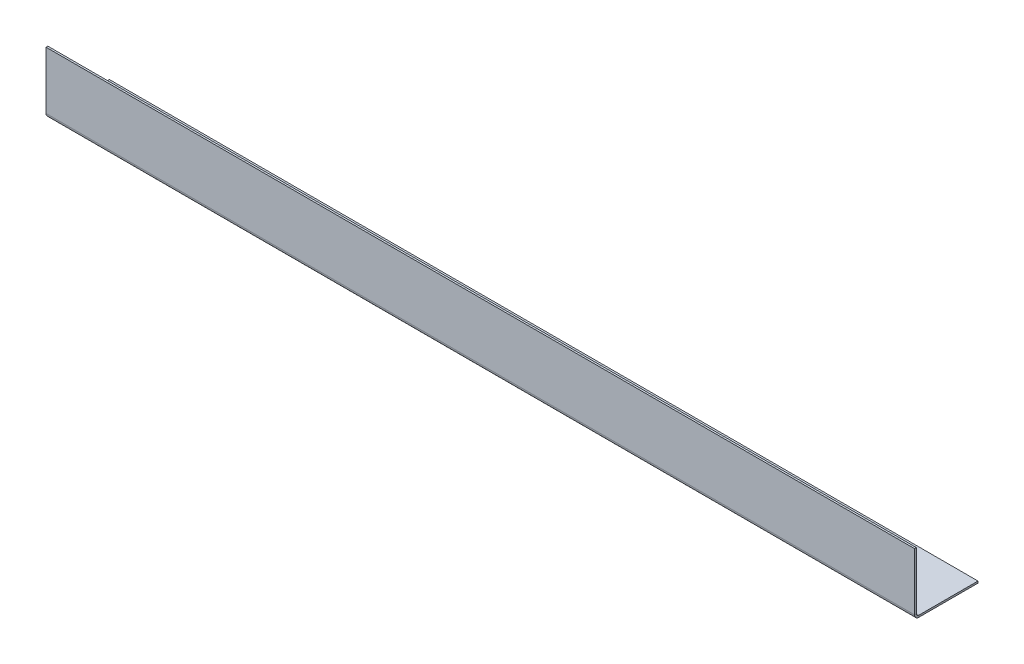
from build123d import *

# Parameters (mm, degrees)
SKETCH1_W                    = 705
SKETCH1_H                    = 50
BOSS_EXTRUDE1_DEPTH          = 2
CONVERT_SOLID1_OUTLINE_W     = 705
CONVERT_SOLID1_OUTLINE_H     = 50
CONVERT_SOLID1_DEPTH         = 0.5
EDGE_FLANGE1_STRIP_W         = 10
EDGE_FLANGE1_STRIP_H         = 1.5
EDGE_FLANGE1_STRIP_CUT_DEPTH = 705
EDGE_FLANGE1_DEPTH           = 705


# Read off the part's stored shape, not the designer's step: Convert-Solid1
# Sheet-metal steps are written as plain solids
with BuildPart() as part:
    # Sketch1 → Boss-Extrude1 (new body)
    with BuildSketch(Plane(origin=(0, 0, 0), x_dir=(1, 0, 0), z_dir=(0, 1, 0))):
        with Locations((-352.5, 25)):
            Rectangle(SKETCH1_W, SKETCH1_H)
    extrude(amount=BOSS_EXTRUDE1_DEPTH)

    # Convert-Solid1 outline → Convert-Solid1 (cut)
    with BuildSketch(Plane(origin=(0, 0, 0), x_dir=(1, 0, 0), z_dir=(0, 1, 0))):
        with Locations((-352.5, 25)):
            Rectangle(CONVERT_SOLID1_OUTLINE_W, CONVERT_SOLID1_OUTLINE_H)
    extrude(amount=CONVERT_SOLID1_DEPTH, mode=Mode.SUBTRACT)

    # Edge-Flange1 strip (across the edge) → Edge-Flange1 strip cut (cut)
    with BuildSketch(Plane(origin=(-705, 2, 0), x_dir=(0, 0, -1), z_dir=(1, 0, 0))):
        with Locations((-3, -0.75)):
            Rectangle(EDGE_FLANGE1_STRIP_W, EDGE_FLANGE1_STRIP_H)
    extrude(amount=EDGE_FLANGE1_STRIP_CUT_DEPTH, mode=Mode.SUBTRACT)

    # Edge-Flange1 section (across the edge) → Edge-Flange1 (add)
    with BuildSketch(Plane(origin=(-705, 2, 0), x_dir=(0, 0, -1), z_dir=(1, 0, 0))):
        with BuildLine():
            Line((-1.5, 2), (-1.5, 48.5))
            Line((-1.5, 48.5), (0, 48.5))
            Line((0, 48.5), (0, 2))
            ThreePointArc((0, 2), (0.585786438, 0.585786438), (2, 0))
            Line((2, 0), (2, -1.5))
            ThreePointArc((2, -1.5), (-0.474873734, -0.474873734), (-1.5, 2))
        make_face()
    extrude(amount=EDGE_FLANGE1_DEPTH)


solid = part.part
